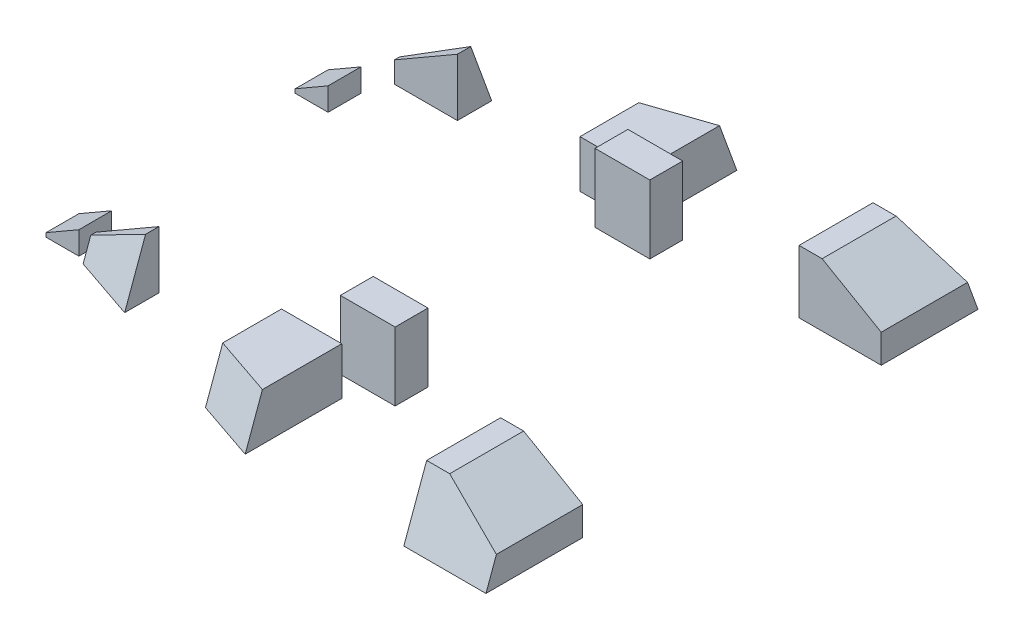
from build123d import *

# Parameters (mm, degrees)
BOSS_EXTRUDE8_DEPTH   = 27
BOSS_EXTRUDE8_START   = 71.5
BOSS_EXTRUDE8_2_DEPTH = 30
BOSS_EXTRUDE8_START_2 = 65
BOSS_EXTRUDE8_3_DEPTH = 12
BOSS_EXTRUDE9_REACH   = 140.598
SKETCH5_W             = 12
SKETCH5_H             = 12
SKETCH13_W            = 20
SKETCH13_H            = 25
BOSS_EXTRUDE10_DEPTH  = 12


with BuildPart() as part:
    # Boss-Extrude8: read off the stored shape, not the designer's step
    # Boss-Extrude8 outline → Boss-Extrude8 (new body)
    with BuildSketch(Plane(origin=(0, 0, -54.5), x_dir=(-1, 0, 0), z_dir=(0, 0, -1))):
        Polygon((-101.5, 16.454482672), (-101.5, 6), (-71.5, 6), (-71.5, 28.913219679), (-79.920834506, 28.913219679), align=None)
    extrude(amount=BOSS_EXTRUDE8_DEPTH)

    # Boss-Extrude8 2 outline → Boss-Extrude8 2 (add)
    with BuildSketch(Plane.YZ.offset(BOSS_EXTRUDE8_START)):
        Polygon((6, -89.839729934), (28.913219679, -81.5), (6, -81.5), align=None)
    extrude(amount=BOSS_EXTRUDE8_2_DEPTH)

    # Boss-Extrude8 3 outline → Boss-Extrude8 3 (cut)
    with BuildSketch(Plane(origin=(0, 0, 0), x_dir=(0.866025403784438, -0.500000000000001, 0), z_dir=(0.500000000000001, 0.866025403784438, 0)).offset(BOSS_EXTRUDE8_START_2)):
        Polygon((54.756863134, 54.5), (79.674337148, 54.5), (79.674337148, 86.034609427), (54.756863134, 81.5), align=None)
    extrude(amount=BOSS_EXTRUDE8_3_DEPTH, mode=Mode.SUBTRACT)


with BuildPart() as body_2:
    # Boss-Extrude8 4: loft between two sections, ruled curve by curve
    boss_extrude8_4_from = [
        Edge.make_line((-8.5, 6, -82.269580064), (-8.5, 23.305515956, -75.970887367)),
        Edge.make_line((-8.5, 6, -82.269580064), (-8.5, 6, -54.5)),
        Edge.make_line((-8.5, 23.305515956, -75.970887367), (-8.5, 23.305515956, -54.5)),
        Edge.make_line((-8.5, 23.305515956, -54.5), (-8.5, 6, -54.5)),
    ]
    boss_extrude8_4_to = [
        Edge.make_line((13.5, 6, -89.766381851), (13.5, 23.305515956, -83.467689154)),
        Edge.make_line((13.5, 6, -89.766381851), (13.5, 6, -54.5)),
        Edge.make_line((13.5, 23.305515956, -83.467689154), (13.5, 23.305515956, -54.5)),
        Edge.make_line((13.5, 23.305515956, -54.5), (13.5, 6, -54.5)),
    ]
    boss_extrude8_4 = Solid(Shell([*[Face.make_surface_from_curves(boss_extrude8_4_from[k], boss_extrude8_4_to[k]) for k in range(4)], Face(Wire(boss_extrude8_4_from)), Face(Wire(boss_extrude8_4_to))]))
    add(boss_extrude8_4)


with BuildPart() as body_3:
    # Boss-Extrude8 5: loft between two sections, ruled curve by curve
    boss_extrude8_5_from = [
        Edge.make_line((-53.267949192, 26.980762114, -59.377914368), (-53.267949192, 6, -67.01428727)),
        Edge.make_line((-53.267949192, 6, -67.01428727), (-53.267949192, 6, -54.5)),
        Edge.make_line((-53.267949192, 6, -54.5), (-53.267949192, 26.980762114, -54.5)),
        Edge.make_line((-53.267949192, 26.980762114, -59.377914368), (-53.267949192, 26.980762114, -54.5)),
    ]
    boss_extrude8_5_to = [
        Edge.make_line((-76.267949192, 13.701705922, -56.373530057), (-76.267949192, 6, -59.176721766)),
        Edge.make_line((-76.267949192, 6, -59.176721766), (-76.267949192, 6, -54.5)),
        Edge.make_line((-76.267949192, 6, -54.5), (-76.267949192, 13.701705922, -54.5)),
        Edge.make_line((-76.267949192, 13.701705922, -56.373530057), (-76.267949192, 13.701705922, -54.5)),
    ]
    boss_extrude8_5 = Solid(Shell([*[Face.make_surface_from_curves(boss_extrude8_5_from[k], boss_extrude8_5_to[k]) for k in range(4)], Face(Wire(boss_extrude8_5_from)), Face(Wire(boss_extrude8_5_to))]))
    add(boss_extrude8_5)


with BuildPart() as body_4:
    # Boss-Extrude9: up to this plane
    boss_extrude9_end = Plane(origin=(-37.039953145, 36.35, -52.5), z_dir=(0.4999999999999954, -0.8660254037844414, 0))
    # Sketch5 → Boss-Extrude9 (new, up to the surface)
    with BuildSketch(Plane(origin=(0, 0, 0), x_dir=(1, 0, 0), z_dir=(0, 1, 0)), mode=Mode.PRIVATE) as boss_extrude9_sk1:
        with Locations((-91.5, -45.5)):
            Rectangle(SKETCH5_W, SKETCH5_H)
    boss_extrude9_tool1 = split(extrude(boss_extrude9_sk1.sketch, amount=BOSS_EXTRUDE9_REACH, mode=Mode.PRIVATE), bisect_by=boss_extrude9_end, keep=Keep.BOTH, mode=Mode.PRIVATE)
    add(boss_extrude9_tool1.solids().sort_by_distance((-91.5, 0, 45.5))[0])
    # Sketch5 → Boss-Extrude9 (new, up to the surface)
    with BuildSketch(Plane(origin=(0, 0, 0), x_dir=(1, 0, 0), z_dir=(0, 1, 0)), mode=Mode.PRIVATE) as boss_extrude9_sk2:
        with Locations((-91.5, 45.5)):
            Rectangle(SKETCH5_W, SKETCH5_H)
    boss_extrude9_tool2 = split(extrude(boss_extrude9_sk2.sketch, amount=BOSS_EXTRUDE9_REACH, mode=Mode.PRIVATE), bisect_by=boss_extrude9_end, keep=Keep.BOTH, mode=Mode.PRIVATE)
    add(boss_extrude9_tool2.solids().sort_by_distance((-91.5, 0, -45.5))[0])


with BuildPart() as body_5:
    # Mirror3: mirrored copy
    add(body_2.part.mirror(Plane.XY))


with BuildPart() as body_6:
    # Mirror3 2: mirrored copy
    add(body_3.part.mirror(Plane.XY))


with BuildPart() as body_7:
    # Mirror3 3: mirrored copy
    add(part.part.mirror(Plane.XY))


with BuildPart() as body_8:
    # Sketch13 → Boss-Extrude10 (new body)
    with BuildSketch(Plane(origin=(0, 0, 52.5), x_dir=(-1, 0, 0), z_dir=(0, 0, -1))):
        with Locations((-20.992681083, 23.85)):
            Rectangle(SKETCH13_W, SKETCH13_H)
    extrude(amount=BOSS_EXTRUDE10_DEPTH)


with BuildPart() as body_9:
    # Mirror5: mirrored copy
    add(body_8.part.mirror(Plane.XY))


solid = Compound([part.part, body_2.part, body_3.part, body_4.part, body_5.part, body_6.part, body_7.part, body_8.part, body_9.part])
